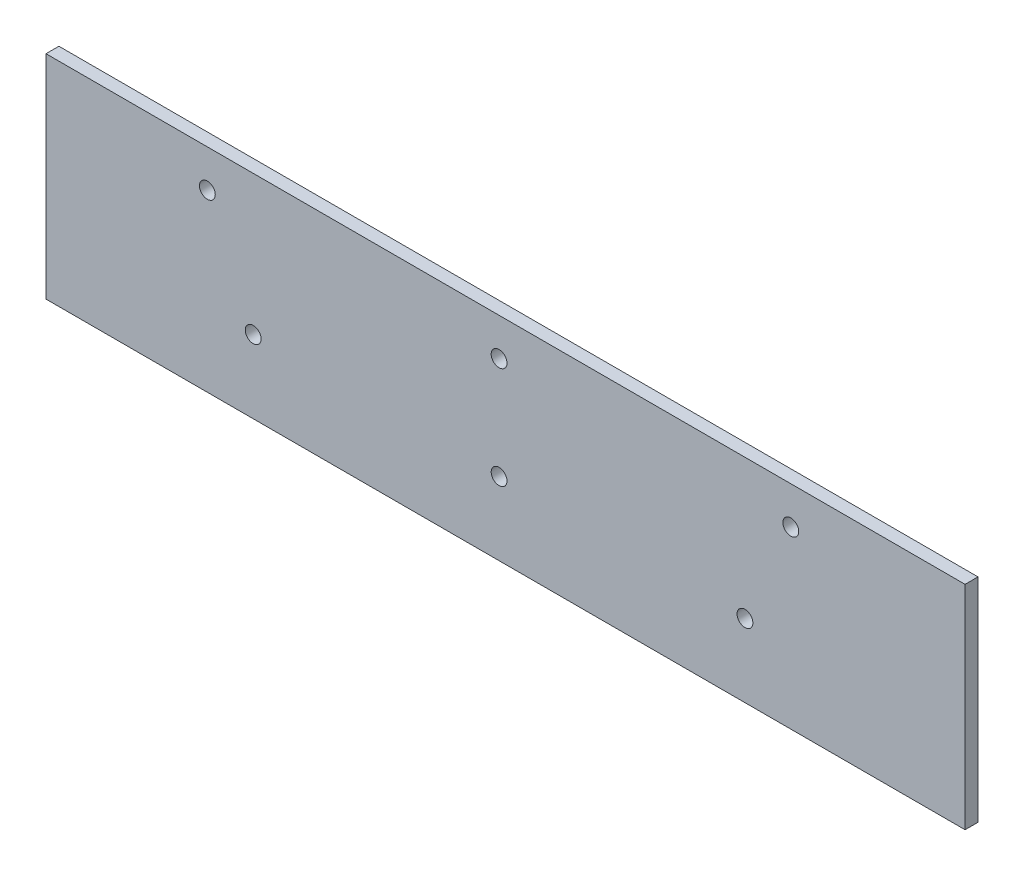
from build123d import *

# Parameters (mm, degrees)
SKETCH1_W             = 220.5325
SKETCH1_H             = 51
BOSS_EXTRUDE1_DEPTH   = 3.1
F_6_CLEARANCE_HOLE1_D = 3.7973


with BuildPart() as part:
    # Sketch1 → Boss-Extrude1 (new body)
    with BuildSketch(Plane.XY):
        Rectangle(SKETCH1_W, SKETCH1_H)
    extrude(amount=BOSS_EXTRUDE1_DEPTH)

    # #6 Clearance Hole1 (through all)
    with Locations(Plane.XY.offset(3.1)):
        with Locations((-71.55, 16.5), (-60.55, -8), (-1.55, -8), (-1.55, 16.5), (68.45, 16.5), (57.45, -8)):
            Hole(F_6_CLEARANCE_HOLE1_D / 2)


solid = part.part
